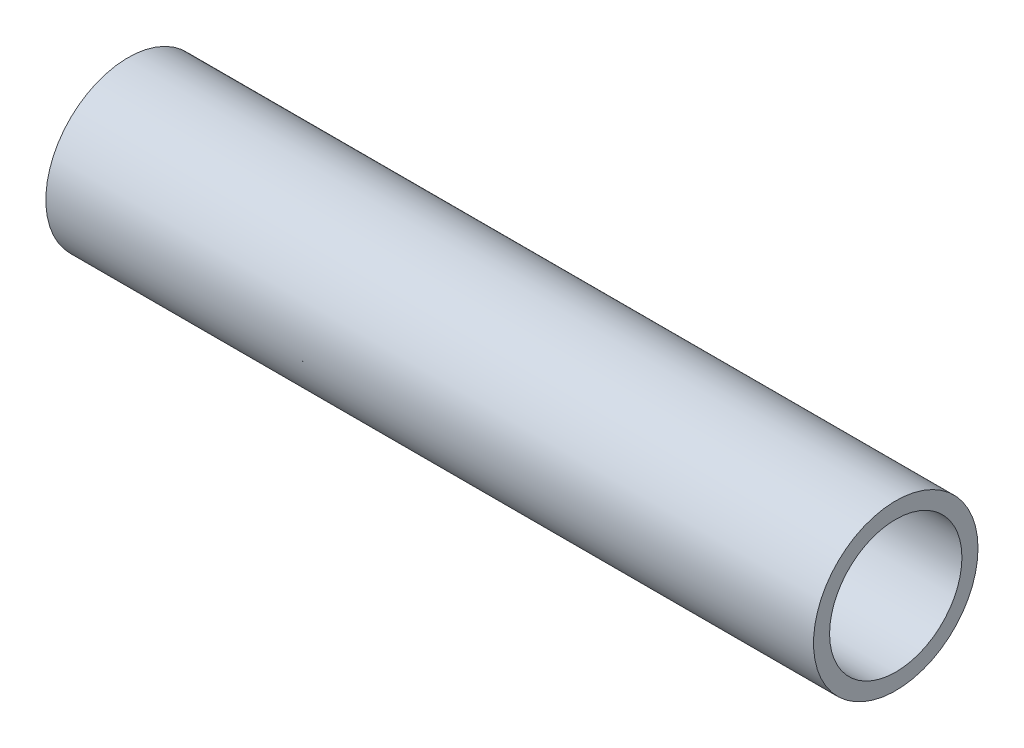
from build123d import *

# Parameters (mm, degrees)
SKETCH1_R           = 57.15
SKETCH1_R_2         = 45.974
BOSS_EXTRUDE1_DEPTH = 533.4
SKETCH2_R           = 57.15
SKETCH2_R_2         = 44.577
BOSS_EXTRUDE2_DEPTH = 95.25


with BuildPart() as part:
    # Sketch1 → Boss-Extrude1 (new body)
    with BuildSketch(Plane(origin=(0, 0, 0), x_dir=(0, 0, -1), z_dir=(1, 0, 0))):
        Circle(SKETCH1_R)
        Circle(SKETCH1_R_2, mode=Mode.SUBTRACT)
    extrude(amount=BOSS_EXTRUDE1_DEPTH)

    # Sketch2 → Boss-Extrude2 (add)
    with BuildSketch(Plane.ZY):
        Circle(SKETCH2_R)
        Circle(SKETCH2_R_2, mode=Mode.SUBTRACT)
    extrude(amount=-BOSS_EXTRUDE2_DEPTH)


solid = part.part
